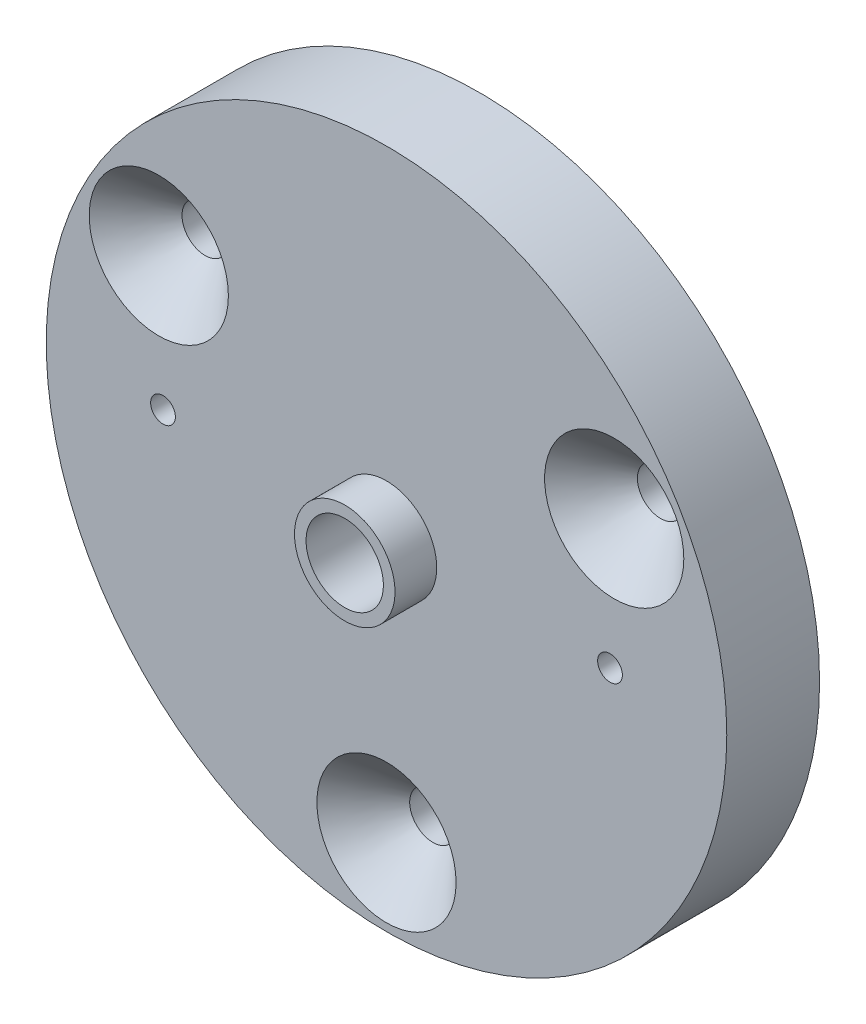
from build123d import *

# Parameters (mm, degrees)
SKETCH_1_R          = 22
EXTRUDE_1_DEPTH     = 6
SKETCH_2_R          = 3.25
EXTRUDE_2_DEPTH     = 2.7
SKETCH_3_R          = 2.5
CUT_EXTRUDE_1_DEPTH = 33.306191357
SKETCH_4_R          = 0.8
CUT_EXTRUDE_2_DEPTH = 32.685959036
SKETCH_5_R          = 13
CUT_EXTRUDE_3_DEPTH = 2
SKETCH_6_R          = 1.5
CUT_EXTRUDE_4_DEPTH = 32.685959036
CHAMFER_1_SIZE      = 3


with BuildPart() as part:
    # Эскиз1 → Бобышка-Вытянуть1 (new body)
    with BuildSketch(Plane.XY):
        Circle(SKETCH_1_R)
    extrude(amount=EXTRUDE_1_DEPTH)

    # Эскиз2 → Бобышка-Вытянуть2 (add)
    with BuildSketch(Plane.XY.offset(6)):
        Circle(SKETCH_2_R)
    extrude(amount=EXTRUDE_2_DEPTH)

    # Эскиз3 → Вырез-Вытянуть1 (cut, through all)
    with BuildSketch(Plane.XY.offset(8.7)):
        Circle(SKETCH_3_R)
    extrude(amount=-CUT_EXTRUDE_1_DEPTH, mode=Mode.SUBTRACT)

    # Эскиз4 → Вырез-Вытянуть2 (cut, through all)
    with BuildSketch(Plane.XY.offset(6)):
        with Locations((-14.45, 0)):
            Circle(SKETCH_4_R)
        with Locations((14.45, 0)):
            Circle(SKETCH_4_R)
    extrude(amount=-CUT_EXTRUDE_2_DEPTH, mode=Mode.SUBTRACT)

    # Эскиз5 → Вырез-Вытянуть3 (cut)
    with BuildSketch(Plane(origin=(0, 0, 0), x_dir=(-1, 0, 0), z_dir=(0, 0, -1))):
        Circle(SKETCH_5_R)
    extrude(amount=-CUT_EXTRUDE_3_DEPTH, mode=Mode.SUBTRACT)

    # Эскиз6 → Вырез-Вытянуть4 (cut, through all)
    with BuildSketch(Plane.XY.offset(6)):
        with Locations((0, -17)):
            Circle(SKETCH_6_R)
        with Locations((-14.722431864, 8.5)):
            Circle(SKETCH_6_R)
        with Locations((14.722431864, 8.5)):
            Circle(SKETCH_6_R)
    extrude(amount=-CUT_EXTRUDE_4_DEPTH, mode=Mode.SUBTRACT)

    # Фаска1
    chamfer_1_edges = [part.edges().sort_by_distance(p)[0] for p in [
        (-1.5, -17, 6),
        (13.222431864, 8.5, 6),
        (-16.222431864, 8.5, 6),
    ]]
    chamfer(chamfer_1_edges, length=CHAMFER_1_SIZE)


solid = part.part
